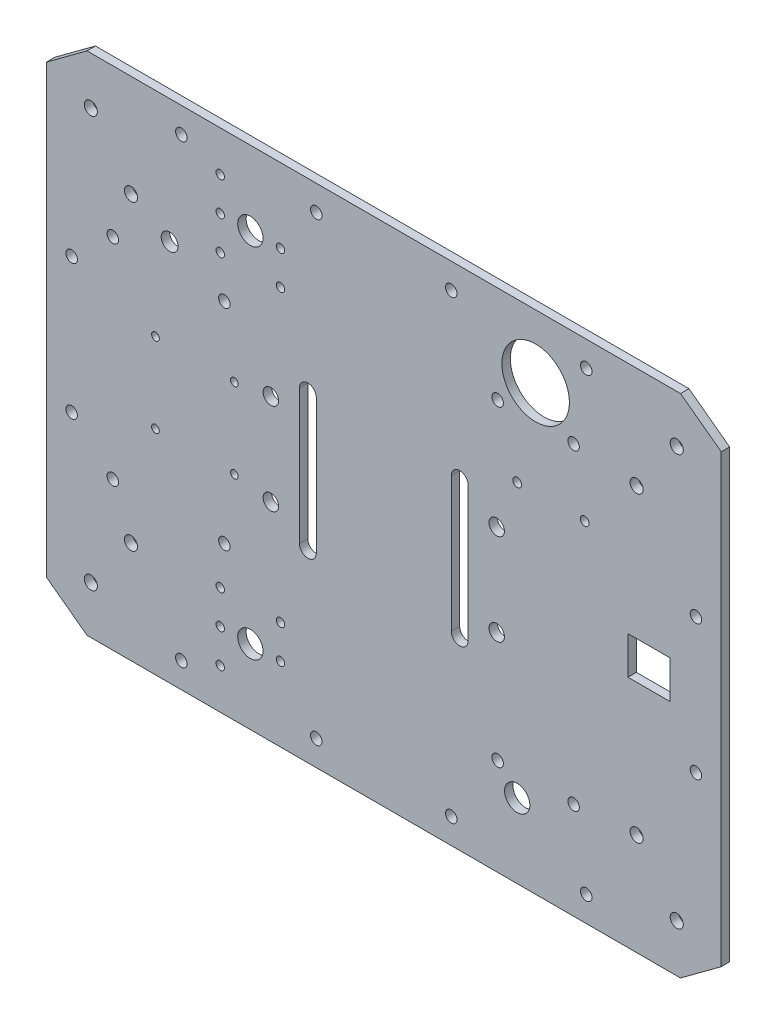
from build123d import *

# Parameters (mm, degrees)
SKETCH1_R                = 2.4638
BOSS_EXTRUDE1_DEPTH      = 3.175
SKETCH2_W                = 15.748
SKETCH2_H                = 14.224
SKETCH2_R                = 2.159
CUT_EXTRUDE1_DEPTH       = 159.781746826
SKETCH5_R                = 12.7
SKETCH5_R_2              = 3.175
SKETCH5_R_3              = 2.159
SKETCH5_R_4              = 1.4478
CUT_EXTRUDE2_DEPTH       = 159.781746826
SKETCH6_R                = 2.159
CUT_EXTRUDE3_DEPTH       = 159.781746826
SKETCH5_3_R              = 2.9083
CUT_EXTRUDE4_DEPTH       = 159.781746826
SKETCH5_4_R              = 1.5875
SKETCH5_4_R_2            = 4.7625
CUT_EXTRUDE5_DEPTH       = 159.781746826
SKETCH5_5_R              = 1.5875
CUT_EXTRUDE6_DEPTH       = 2.54
SKETCH5_6_R              = 1.5875
CUT_EXTRUDE7_DEPTH       = 159.781746826
SKETCH5_7_R              = 1.651
CUT_EXTRUDE8_DEPTH       = 2.54
SKETCH5_9_R              = 1.651
CUT_EXTRUDE9_DEPTH       = 2.54
CUT_EXTRUDE13_DEPTH      = 159.781746826
CUT_EXTRUDE13_DEPTH_BACK = 159.781746826
SKETCH5_12_R             = 1.651
SKETCH5_13_R             = 1.5875
CUT_EXTRUDE14_DEPTH      = 159.781746826


with BuildPart() as part:
    # Sketch1 → Boss-Extrude1 (new body)
    with BuildSketch(Plane.XY):
        Polygon((-111.686526805, -95.25), (-127, -83.918625912), (-127, 83.918625912), (-111.686526805, 95.25), (111.686526805, 95.25), (127, 83.918625912), (127, -83.918625912), (111.686526805, -95.25), align=None)
        with Locations((-95.147512794, 56.885632681)):
            Circle(SKETCH1_R, mode=Mode.SUBTRACT)
        with Locations((-110.256011578, 77.303596941)):
            Circle(SKETCH1_R, mode=Mode.SUBTRACT)
        with Locations((110.256011578, 77.303596941)):
            Circle(SKETCH1_R, mode=Mode.SUBTRACT)
        with Locations((95.147512794, 56.885632681)):
            Circle(SKETCH1_R, mode=Mode.SUBTRACT)
        with Locations((-110.256011578, -77.303596941)):
            Circle(SKETCH1_R, mode=Mode.SUBTRACT)
        with Locations((-95.147512794, -56.885632681)):
            Circle(SKETCH1_R, mode=Mode.SUBTRACT)
        with Locations((110.256011578, -77.303596941)):
            Circle(SKETCH1_R, mode=Mode.SUBTRACT)
        with Locations((95.147512794, -56.885632681)):
            Circle(SKETCH1_R, mode=Mode.SUBTRACT)
    extrude(amount=BOSS_EXTRUDE1_DEPTH)

    # Sketch2 → Cut-Extrude1 (cut, through all)
    with BuildSketch(Plane.XY.offset(3.175)):
        with Locations((99.772576703, 0)):
            Rectangle(SKETCH2_W, SKETCH2_H)
        with Locations((42.8625, 58.7375)):
            Circle(SKETCH2_R)
        with Locations((42.8625, -58.7375)):
            Circle(SKETCH2_R)
        with Locations((71.4375, -58.7375)):
            Circle(SKETCH2_R)
        with Locations((71.4375, 58.7375)):
            Circle(SKETCH2_R)
    extrude(amount=-CUT_EXTRUDE1_DEPTH, mode=Mode.SUBTRACT)

    # Sketch5 → Cut-Extrude2 (cut, through all)
    with BuildSketch(Plane(origin=(0, 0, 0), x_dir=(-1, 0, 0), z_dir=(0, 0, -1))):
        with Locations((-57.15, 71.4375)):
            Circle(SKETCH5_R)
        with Locations((80.594630637, 48.58004)):
            Circle(SKETCH5_R_2)
        with Locations((59.995230637, -39.49954)):
            Circle(SKETCH5_R_3)
        with Locations((101.994130637, -39.49954)):
            Circle(SKETCH5_R_3)
        with Locations((101.994130637, 39.49954)):
            Circle(SKETCH5_R_3)
        with Locations((59.995230637, 39.49954)):
            Circle(SKETCH5_R_3)
        with BuildLine():
            Line((-31.75, 25.4), (-31.75, -25.4))
            ThreePointArc((-31.75, -25.4), (-28.575, -28.575), (-25.4, -25.4))
            Line((-25.4, -25.4), (-25.4, 25.4))
            ThreePointArc((-25.4, 25.4), (-28.575, 28.575), (-31.75, 25.4))
        make_face()
        with Locations((85.937708857, 15.03413)):
            Circle(SKETCH5_R_4)
        with Locations((56.219708857, 15.03413)):
            Circle(SKETCH5_R_4)
        with Locations((56.219708857, -15.03413)):
            Circle(SKETCH5_R_4)
        with Locations((85.937708857, -15.03413)):
            Circle(SKETCH5_R_4)
        with BuildLine():
            ThreePointArc((31.75, 25.4), (28.575, 28.575), (25.4, 25.4))
            Line((25.4, 25.4), (25.4, -25.4))
            ThreePointArc((25.4, -25.4), (28.575, -28.575), (31.75, -25.4))
            Line((31.75, -25.4), (31.75, 25.4))
        make_face()
    extrude(amount=-CUT_EXTRUDE2_DEPTH, mode=Mode.SUBTRACT)

    # Sketch6 → Cut-Extrude3 (cut, through all)
    with BuildSketch(Plane(origin=(0, 0, 0), x_dir=(-1, 0, 0), z_dir=(0, 0, -1))):
        with Locations((-76.2, -85.725)):
            Circle(SKETCH6_R)
        with Locations((-25.4, -85.725)):
            Circle(SKETCH6_R)
        with Locations((25.4, -85.725)):
            Circle(SKETCH6_R)
        with Locations((76.2, -85.725)):
            Circle(SKETCH6_R)
        with Locations((76.2, 85.725)):
            Circle(SKETCH6_R)
        with Locations((25.4, 85.725)):
            Circle(SKETCH6_R)
        with Locations((-25.4, 85.725)):
            Circle(SKETCH6_R)
        with Locations((-76.2, 85.725)):
            Circle(SKETCH6_R)
        with Locations((117.475, -25.4)):
            Circle(SKETCH6_R)
        with Locations((117.475, 25.4)):
            Circle(SKETCH6_R)
        with Locations((-117.475, 25.4)):
            Circle(SKETCH6_R)
        with Locations((-117.475, -25.4)):
            Circle(SKETCH6_R)
    extrude(amount=-CUT_EXTRUDE3_DEPTH, mode=Mode.SUBTRACT)

    # Sketch5<3> → Cut-Extrude4 (cut, through all)
    with BuildSketch(Plane(origin=(0, 0, 0), x_dir=(-1, 0, 0), z_dir=(0, 0, -1))):
        with Locations((-42.5, 17.2)):
            Circle(SKETCH5_3_R)
        with Locations((-42.5, -17.2)):
            Circle(SKETCH5_3_R)
        with Locations((42.5, -17.2)):
            Circle(SKETCH5_3_R)
        with Locations((42.5, 17.2)):
            Circle(SKETCH5_3_R)
    extrude(amount=-CUT_EXTRUDE4_DEPTH, mode=Mode.SUBTRACT)

    # Sketch5<4> → Cut-Extrude5 (cut, through all)
    with BuildSketch(Plane(origin=(0, 0, 0), x_dir=(-1, 0, 0), z_dir=(0, 0, -1))):
        with Locations((61.544630637, -54.61)):
            Circle(SKETCH5_4_R)
        with Locations((61.544630637, -67.31)):
            Circle(SKETCH5_4_R)
        with Locations((61.544630637, 54.61)):
            Circle(SKETCH5_4_R)
        with Locations((61.544630637, -80.01)):
            Circle(SKETCH5_4_R)
        with Locations((-50.215369363, -67.31)):
            Circle(SKETCH5_4_R_2)
        with Locations((50.215369363, -67.31)):
            Circle(SKETCH5_4_R_2)
        with Locations((61.544630637, 67.31)):
            Circle(SKETCH5_4_R)
        with Locations((61.544630637, 80.01)):
            Circle(SKETCH5_4_R)
        with Locations((50.215369363, 67.31)):
            Circle(SKETCH5_4_R_2)
    extrude(amount=-CUT_EXTRUDE5_DEPTH, mode=Mode.SUBTRACT)

    # Sketch5<5> → Cut-Extrude6 (cut)
    with BuildSketch(Plane(origin=(0, 0, 0), x_dir=(-1, 0, 0), z_dir=(0, 0, -1))):
        with Locations((38.886108088, 67.31)):
            Circle(SKETCH5_5_R)
        with Locations((38.886108088, 54.61)):
            Circle(SKETCH5_5_R)
        with Locations((38.886108088, -67.31)):
            Circle(SKETCH5_5_R)
    extrude(amount=-CUT_EXTRUDE6_DEPTH, mode=Mode.SUBTRACT)

    # Sketch5<6> → Cut-Extrude7 (cut, through all)
    with BuildSketch(Plane(origin=(0, 0, 0), x_dir=(-1, 0, 0), z_dir=(0, 0, -1))):
        with Locations((38.886108088, 67.31)):
            Circle(SKETCH5_6_R)
        with Locations((38.886108088, 54.61)):
            Circle(SKETCH5_6_R)
        with Locations((38.886108088, -67.31)):
            Circle(SKETCH5_6_R)
    extrude(amount=-CUT_EXTRUDE7_DEPTH, mode=Mode.SUBTRACT)

    # Sketch5<7> → Cut-Extrude8 (cut)
    with BuildSketch(Plane(origin=(0, 0, 0), x_dir=(-1, 0, 0), z_dir=(0, 0, -1))):
        with Locations((-50.215369363, 35.56)):
            Circle(SKETCH5_7_R)
    extrude(amount=-CUT_EXTRUDE8_DEPTH, mode=Mode.SUBTRACT)

    # Sketch5<9> → Cut-Extrude9 (cut)
    with BuildSketch(Plane(origin=(0, 0, 0), x_dir=(-1, 0, 0), z_dir=(0, 0, -1))):
        with Locations((-50.215369363, 35.56)):
            Circle(SKETCH5_9_R)
        with Locations((-75.615369363, 35.627632966)):
            Circle(SKETCH5_9_R)
    extrude(amount=-CUT_EXTRUDE9_DEPTH, mode=Mode.SUBTRACT)

    # Sketch5<12> → Cut-Extrude13 (cut, two sides: drawn at the far end of the back side and taken through both)
    with BuildSketch(Plane(origin=(0, 0, 0), x_dir=(-1, 0, 0), z_dir=(0, 0, -1)).offset(-CUT_EXTRUDE13_DEPTH_BACK)):
        with Locations((-50.215369363, 35.56)):
            Circle(SKETCH5_12_R)
        with Locations((-75.615369363, 35.627632966)):
            Circle(SKETCH5_12_R)
    extrude(amount=CUT_EXTRUDE13_DEPTH + CUT_EXTRUDE13_DEPTH_BACK, mode=Mode.SUBTRACT)

    # Sketch5<13> → Cut-Extrude14 (cut, through all)
    with BuildSketch(Plane(origin=(0, 0, 0), x_dir=(-1, 0, 0), z_dir=(0, 0, -1))):
        with Locations((38.886108088, -54.61)):
            Circle(SKETCH5_13_R)
    extrude(amount=-CUT_EXTRUDE14_DEPTH, mode=Mode.SUBTRACT)


solid = part.part
